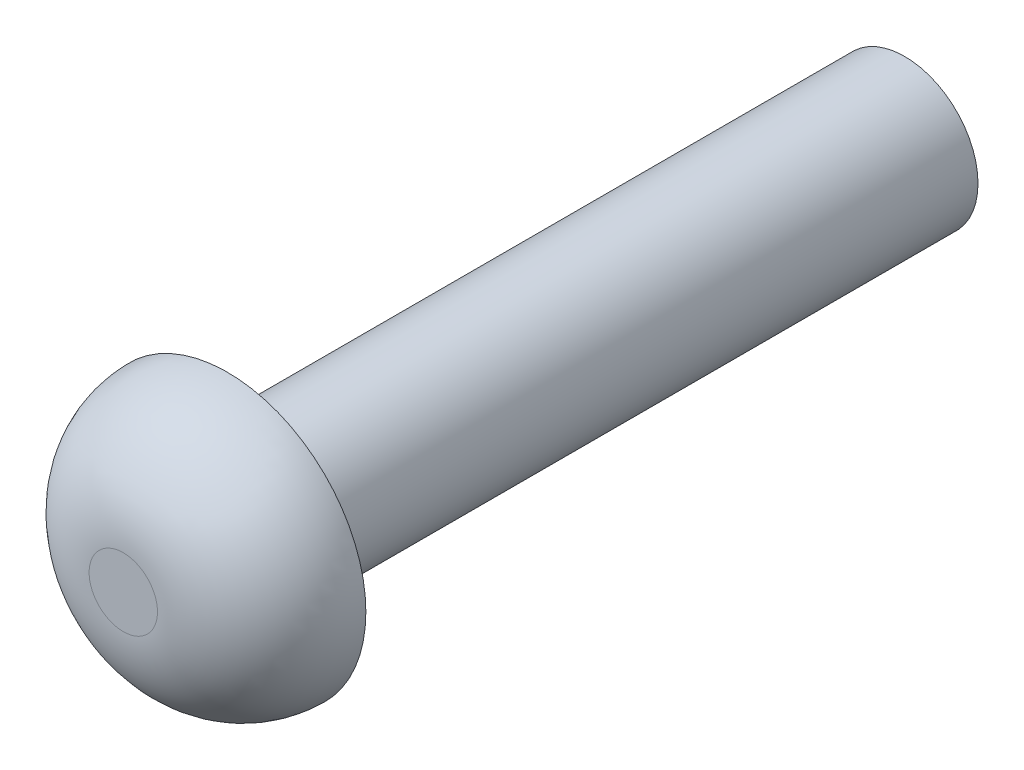
from build123d import *

# Parameters (mm, degrees)
ESBO_O1_R                = 1.125
RESSALTO_EXTRUS_O1_DEPTH = 12
ESBO_O2_R                = 2.125
RESSALTO_EXTRUS_O2_DEPTH = 1.6
FILETE1_R                = 1.6


with BuildPart() as part:
    # Esboço1 → Ressalto-extrusão1 (new body)
    with BuildSketch(Plane.XY):
        Circle(ESBO_O1_R)
    extrude(amount=RESSALTO_EXTRUS_O1_DEPTH)

    # Esboço2 → Ressalto-extrusão2 (add)
    with BuildSketch(Plane.XY.offset(12)):
        Circle(ESBO_O2_R)
    extrude(amount=-RESSALTO_EXTRUS_O2_DEPTH)

    # Filete1
    filete1_edges = [part.edges().sort_by_distance(p)[0] for p in [
        (-2.125, 0, 12),
    ]]
    fillet(filete1_edges, radius=FILETE1_R - 0.0001)  # a hair under: the kernel refuses the full size


solid = part.part
